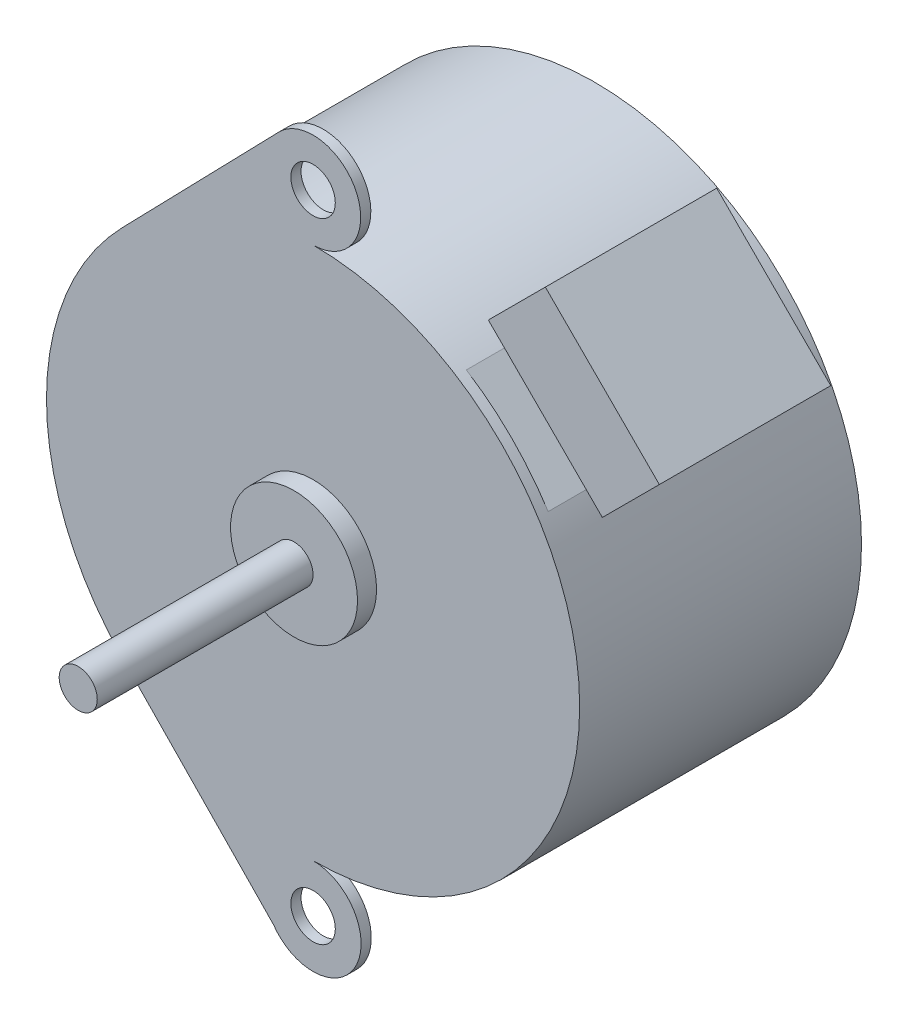
from build123d import *

# Parameters (mm, degrees)
SKETCH1_R           = 21
BOSS_EXTRUDE1_DEPTH = 0.8
SKETCH2_R           = 1.75
BOSS_EXTRUDE2_DEPTH = 0.8
BOSS_EXTRUDE4_START = -21.4
SKETCH5_R           = 21
BOSS_EXTRUDE4_DEPTH = 21.4
SKETCH6_R           = 4
BOSS_EXTRUDE5_DEPTH = 22.4
SKETCH7_R           = 5
BOSS_EXTRUDE6_DEPTH = 2.3
SKETCH8_R           = 1.5
BOSS_EXTRUDE7_DEPTH = 19.3
BOSS_EXTRUDE8_DEPTH = 16.5
CUT_EXTRUDE1_DEPTH  = 3


with BuildPart() as part:
    # Sketch1 → Boss-Extrude1 (new body)
    with BuildSketch(Plane.XY):
        Circle(SKETCH1_R)
    extrude(amount=BOSS_EXTRUDE1_DEPTH)

    # Sketch5 → Boss-Extrude4 (add)
    with BuildSketch(Plane.XY.offset(BOSS_EXTRUDE4_START)):
        Circle(SKETCH5_R)
    extrude(amount=BOSS_EXTRUDE4_DEPTH)

    # Sketch6 → Boss-Extrude5 (add)
    with BuildSketch(Plane.XY):
        Circle(SKETCH6_R)
    extrude(amount=-BOSS_EXTRUDE5_DEPTH)

    # Sketch7 → Boss-Extrude6 (add)
    with BuildSketch(Plane.XY):
        Circle(SKETCH7_R)
    extrude(amount=BOSS_EXTRUDE6_DEPTH)

    # Sketch8 → Boss-Extrude7 (add)
    with BuildSketch(Plane.XY):
        Circle(SKETCH8_R)
    extrude(amount=BOSS_EXTRUDE7_DEPTH)



with BuildPart() as body_2:
    # Sketch2 → Boss-Extrude2 (new body)
    with BuildSketch(Plane.XY):
        with BuildLine():
            Line((-15.059109941, -14.636365935), (-3.121960614, -26.918297453))
            ThreePointArc((-3.121960614, -26.918297453), (3.345627102, -26.547432807), (0, -21))
            ThreePointArc((0, -21), (21, 0), (0, 21))
            ThreePointArc((0, 21), (3.453368527, 26.211761203), (-2.692266738, 27.360402232))
            Line((-2.692266738, 27.360402232), (-15.059109941, 14.636365935))
            ThreePointArc((-15.059109941, 14.636365935), (-21, 0), (-15.059109941, -14.636365935))
        make_face()
        with Locations((0, 24.75)):
            Circle(SKETCH2_R, mode=Mode.SUBTRACT)
        with Locations((0, -24.782581323)):
            Circle(SKETCH2_R, mode=Mode.SUBTRACT)
    extrude(amount=BOSS_EXTRUDE2_DEPTH)


with BuildPart() as part_1:
    add(part.part)

    add(body_2.part)  # Boss-Extrude8 merges body 2
    # Sketch9 → Boss-Extrude8 (add)
    with BuildSketch(Plane.XY):
        Polygon((18.985817075, 10.005560954), (10.005560954, 18.985817075), (14.495689014, 23.475945135), (23.475945135, 14.495689014), align=None)
    extrude(amount=-BOSS_EXTRUDE8_DEPTH)

    # Sketch10 → Cut-Extrude1 (cut)
    with BuildSketch(Plane.XY):
        Polygon((10.005560954, 18.985817075), (18.985817075, 10.005560954), (23.552732659, 14.572476538), (14.572476538, 23.552732659), align=None)
    extrude(amount=-CUT_EXTRUDE1_DEPTH, mode=Mode.SUBTRACT)


solid = part_1.part
